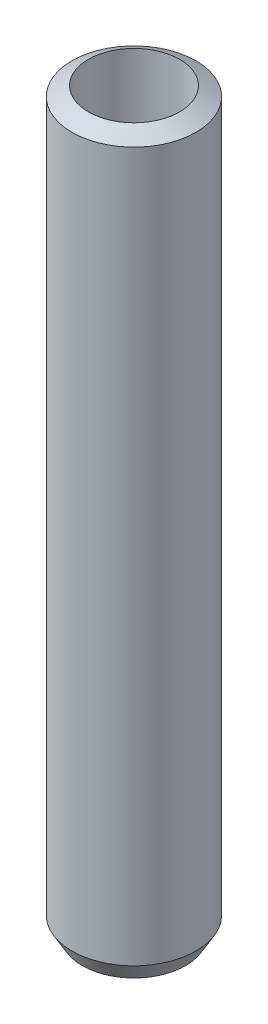
from build123d import *

# Parameters (mm, degrees)
SKETCH1_R           = 12.5
BOSS_EXTRUDE1_DEPTH = 148.592827
SKETCH2_R           = 9.192275911
CUT_EXTRUDE1_DEPTH  = 150.640663711
CHAMFER1_SIZE       = 2.069559
CHAMFER1_SIZE_2     = 3.584581


with BuildPart() as part:
    # Sketch1 → Boss-Extrude1 (new body)
    with BuildSketch(Plane(origin=(0, 0, 0), x_dir=(1, 0, 0), z_dir=(0, 1, 0))):
        with Locations(Location((0, 0, 0), (0, 0, 270))):
            Circle(SKETCH1_R)
    extrude(amount=BOSS_EXTRUDE1_DEPTH)

    # Sketch2 → Cut-Extrude1 (cut, through all)
    with BuildSketch(Plane(origin=(0, 0, 0), x_dir=(1, 0, 0), z_dir=(0, 1, 0))):
        with Locations(Location((0, 0, 0), (0, 0, 270))):
            Circle(SKETCH2_R)
    extrude(amount=CUT_EXTRUDE1_DEPTH, mode=Mode.SUBTRACT)

    # Chamfer1
    # the kernel refuses this chamfer: 3.584581, 2.069559 mm, written as the material it takes off along each edge
    with BuildSketch(Plane(origin=(0, 148.592827, 0), x_dir=(0, 0, 1), z_dir=(-1, 0, 0))) as chamfer1_piece_1:
        Polygon((12.5, -CHAMFER1_SIZE), (12.5 - CHAMFER1_SIZE_2, 0), (12.5, 0), align=None)
    revolve(axis=Axis((0, 148.592827, 0), (0, 1, 0)), mode=Mode.SUBTRACT)
    with BuildSketch(Plane(origin=(0, 0, 0), x_dir=(0, 0, 1), z_dir=(-1, 0, 0))) as chamfer1_piece_2:
        Polygon((12.5, CHAMFER1_SIZE_2), (12.5 - CHAMFER1_SIZE, 0), (12.5, 0), align=None)
    revolve(axis=Axis((0, 0, 0), (0, 1, 0)), mode=Mode.SUBTRACT)


solid = part.part
